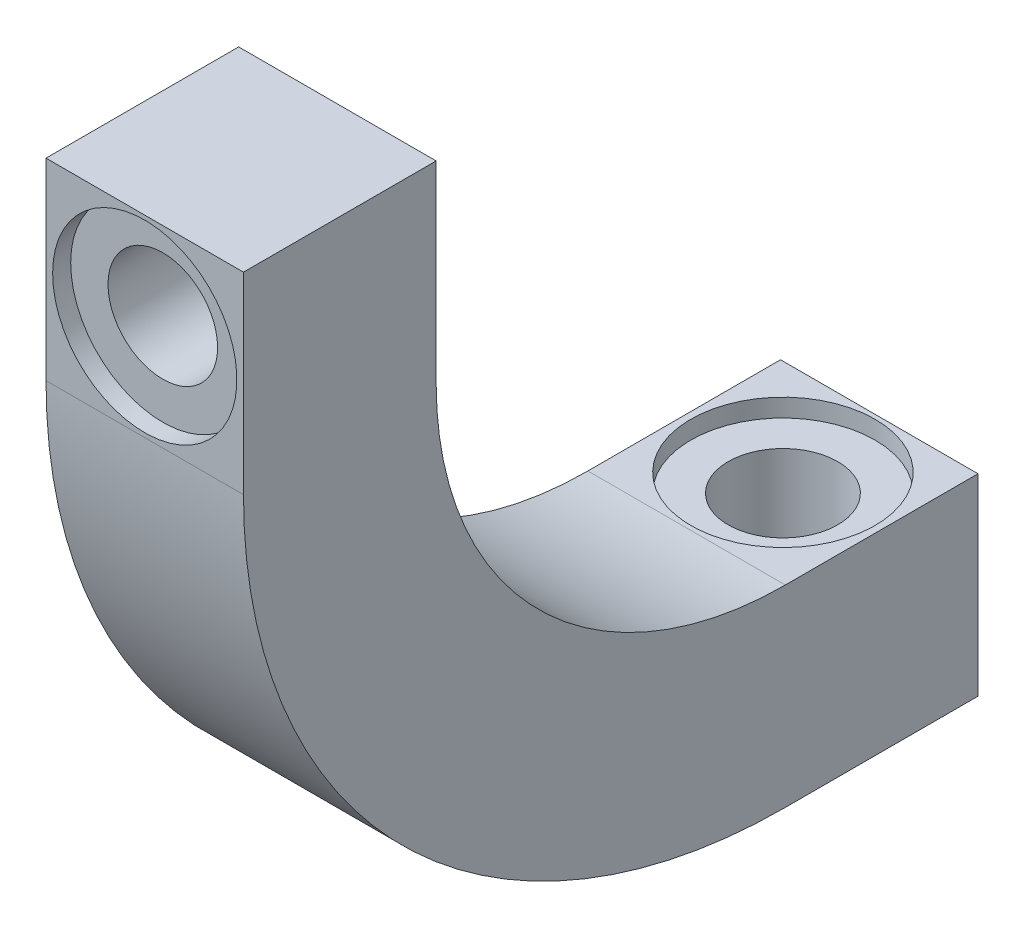
from build123d import *

# Parameters (mm, degrees)
BOSS_EXTRUDE1_DEPTH      = 4.1
BOSS_EXTRUDE1_DEPTH_BACK = 4.1
SKETCH7_R                = 1.75
CUT_EXTRUDE1_DEPTH       = 38.700265251
SKETCH8_R                = 1.75
CUT_EXTRUDE2_DEPTH       = 38.700265251
SKETCH11_R               = 2.275
CUT_EXTRUDE6_DEPTH       = 6
SKETCH12_R               = 2.275
CUT_EXTRUDE7_DEPTH       = 6
SKETCH13_R               = 3.825
CUT_EXTRUDE8_DEPTH       = 0.75
SKETCH14_R               = 3.825
CUT_EXTRUDE10_DEPTH      = 0.75


with BuildPart() as part:
    # Sketch5 → Boss-Extrude1 (new, two sides: drawn at the far end of the back side and taken through both)
    with BuildSketch(Plane(origin=(0, 0, 0), x_dir=(0, 0, -1), z_dir=(1, 0, 0)).offset(-BOSS_EXTRUDE1_DEPTH_BACK)):
        with BuildLine():
            Line((-18.5, 4), (-18.5, 0))
            Line((-18.5, 0), (-18.5, -4))
            ThreePointArc((-18.5, -4), (-14.253048327, -14.253048327), (-4, -18.5))
            Line((-4, -18.5), (0, -18.5))
            Line((0, -18.5), (4, -18.5))
            Line((4, -18.5), (4, -26.5))
            Line((4, -26.5), (-4, -26.5))
            ThreePointArc((-4, -26.5), (-19.909902577, -19.909902577), (-26.5, -4))
            Line((-26.5, -4), (-26.5, 4))
            Line((-26.5, 4), (-18.5, 4))
        make_face()
    extrude(amount=BOSS_EXTRUDE1_DEPTH + BOSS_EXTRUDE1_DEPTH_BACK)

    # Sketch7 → Cut-Extrude1 (cut, through all)
    with BuildSketch(Plane.XY):
        Circle(SKETCH7_R)
    extrude(amount=CUT_EXTRUDE1_DEPTH, mode=Mode.SUBTRACT)

    # Sketch8 → Cut-Extrude2 (cut, through all)
    with BuildSketch(Plane(origin=(0, 0, 0), x_dir=(1, 0, 0), z_dir=(0, 1, 0))):
        Circle(SKETCH8_R)
    extrude(amount=-CUT_EXTRUDE2_DEPTH, mode=Mode.SUBTRACT)

    # Sketch11 → Cut-Extrude6 (cut)
    with BuildSketch(Plane.XZ.offset(18.5)):
        Circle(SKETCH11_R)
    extrude(amount=CUT_EXTRUDE6_DEPTH, mode=Mode.SUBTRACT)

    # Sketch12 → Cut-Extrude7 (cut)
    with BuildSketch(Plane.XY.offset(26.5)):
        Circle(SKETCH12_R)
    extrude(amount=-CUT_EXTRUDE7_DEPTH, mode=Mode.SUBTRACT)

    # Sketch13 → Cut-Extrude8 (cut)
    with BuildSketch(Plane.XZ.offset(18.5)):
        Circle(SKETCH13_R)
    extrude(amount=CUT_EXTRUDE8_DEPTH, mode=Mode.SUBTRACT)

    # Sketch14 → Cut-Extrude10 (cut)
    with BuildSketch(Plane(origin=(0, 0, 26.5), x_dir=(1, 0, 0), z_dir=(0, 0, -1))):
        Circle(SKETCH14_R)
    extrude(amount=CUT_EXTRUDE10_DEPTH, mode=Mode.SUBTRACT)


solid = part.part
